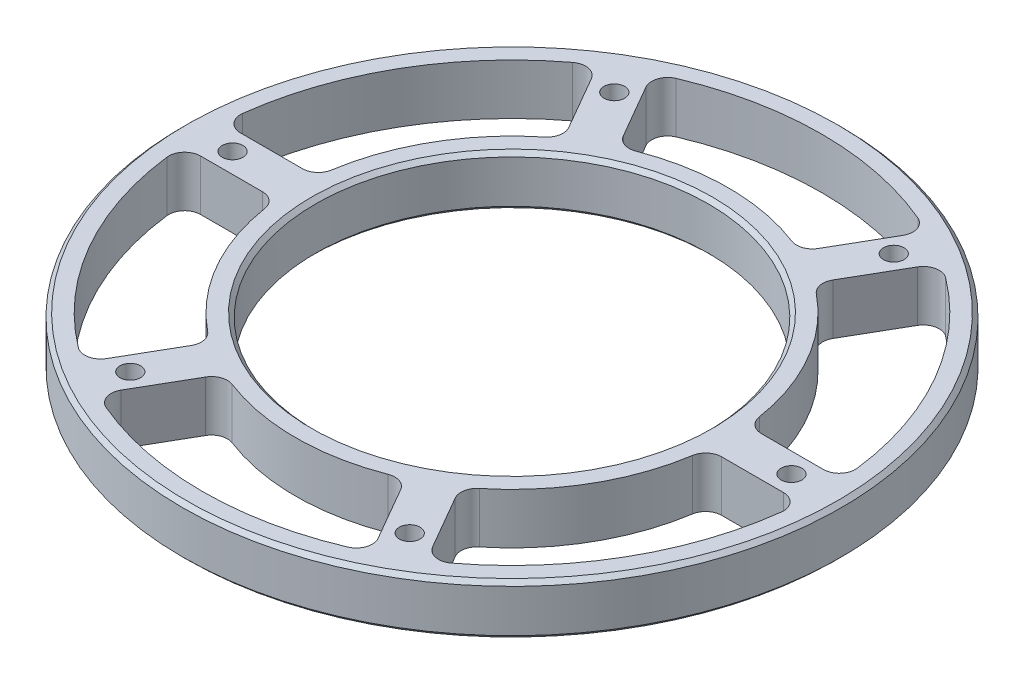
from build123d import *

# Parameters (mm, degrees)
F_6_0_204_DIAMETER_HOLE1_D = 5.1816
CIRPATTERN3_COUNT          = 6
CUT_EXTRUDE1_DEPTH         = 118.43208675655899
FILLET1_R                  = 4
CIRPATTERN4_COUNT          = 6
FILLET1_OF_CIRPATTERN4_R   = 4
CHAMFER1_SIZE              = 1
CHAMFER2_SIZE              = 1


with BuildPart() as part:
    # Sketch2 → Revolve1 (revolve)
    with BuildSketch(Plane(origin=(0, 0, 0), x_dir=(0, 0, -1), z_dir=(1, 0, 0))):
        Polygon((-49.2125, -4.7e-16), (-82.55, -4.08e-15), (-82.55, 12.699999999999996), (-49.2125, 12.699999999999996), align=None)
    revolve(axis=Axis((0, -0.6350000000000036, 0), (0, 1, 0)))

    # #6 (0.204) Diameter Hole1 (through all)
    with Locations(Plane(origin=(0, 12.699999999999996, 0), x_dir=(1, 0, 0), z_dir=(0, 1, 0))):
        with Locations((-35, 60.621778265)):
            f_6_0_204_diameter_hole1 = Hole(F_6_0_204_DIAMETER_HOLE1_D / 2)

    # CirPattern3: #6 (0.204) Diameter Hole1 ×6 about axis
    cirpattern3_axis = Axis((0, -0.6350000000000036, 0), (0, 1, 0))
    for i in range(1, CIRPATTERN3_COUNT):
        add(f_6_0_204_diameter_hole1.rotate(cirpattern3_axis, i * 360 / CIRPATTERN3_COUNT), mode=Mode.SUBTRACT)

    # Sketch8 → Cut-Extrude1 (cut, through all)
    with BuildSketch(Plane(origin=(0, 12.699999999999996, 0), x_dir=(1, 0, 0), z_dir=(0, 1, 0))):
        with BuildLine():
            Line((-22.660589701137386, 49.24929269184184), (-34.36419588509058, 69.52053323422602))
            ThreePointArc((-34.36419588509058, 69.52053323422602), (4.75e-15, 77.55000000000001), (34.36419588509058, 69.52053323422602))
            Line((34.36419588509058, 69.52053323422602), (22.660589701137386, 49.24929269184184))
            ThreePointArc((22.660589701137386, 49.24929269184184), (3.32e-15, 54.2125), (-22.660589701137386, 49.24929269184184))
        make_face()
    cut_extrude1 = extrude(amount=-CUT_EXTRUDE1_DEPTH, mode=Mode.SUBTRACT)

    # Fillet1
    fillet1_edges = [part.edges().sort_by_distance(p)[0] for p in [
        (-22.660589701137383, 6.349999999999998, -49.24929269184184),
        (22.66058970113739, 6.349999999999998, -49.249292691841845),
        (34.36419588509058, 6.349999999999998, -69.52053323422604),
        (-34.36419588509058, 6.349999999999998, -69.52053323422604),
    ]]
    fillet(fillet1_edges, radius=FILLET1_R)

    # CirPattern4: Cut-Extrude1 ×6 about axis
    cirpattern4_axis = Axis((0, -0.6350000000000036, 0), (0, 1, 0))
    for i in range(1, CIRPATTERN4_COUNT):
        add(cut_extrude1.rotate(cirpattern4_axis, i * 360 / CIRPATTERN4_COUNT), mode=Mode.SUBTRACT)

    # Fillet1 of CirPattern4
    fillet1_of_cirpattern4_edges = [part.edges().sort_by_distance(p)[0] for p in [
        (-53.98143344011902, 6.349999999999998, -4.9999999999999325),
        (-31.320843738981637, 6.349999999999998, -44.24929269184193),
        (-43.02444992293479, 6.349999999999998, -64.52053323422614),
        (-77.38864580802537, 6.349999999999998, -4.999999999999911),
        (-31.32084373898165, 6.349999999999998, 44.2492926918419),
        (-53.981433440119034, 6.349999999999998, 4.999999999999911),
        (-77.38864580802539, 6.349999999999998, 4.999999999999886),
        (-43.024449922934814, 6.349999999999998, 64.52053323422612),
        (22.660589701137376, 6.349999999999998, 49.24929269184184),
        (-22.660589701137397, 6.349999999999998, 49.249292691841845),
        (-34.36419588509059, 6.349999999999998, 69.52053323422604),
        (34.364195885090574, 6.349999999999998, 69.52053323422604),
        (53.98143344011902, 6.349999999999998, 4.999999999999954),
        (31.320843738981615, 6.349999999999998, 44.24929269184194),
        (43.024449922934764, 6.349999999999998, 64.52053323422615),
        (77.38864580802537, 6.349999999999998, 4.99999999999994),
        (31.320843738981637, 6.349999999999998, -44.249292691841916),
        (53.981433440119034, 6.349999999999998, -4.9999999999999325),
        (77.38864580802537, 6.349999999999998, -4.999999999999911),
        (43.02444992293479, 6.349999999999998, -64.52053323422614),
    ]]
    fillet(fillet1_of_cirpattern4_edges, radius=FILLET1_OF_CIRPATTERN4_R)

    # Chamfer1
    chamfer1_edges = [part.edges().sort_by_distance(p)[0] for p in [
        (6.03e-15, 12.699999999999996, -49.2125),
        (6.03e-15, -4.4e-16, -49.2125),
    ]]
    chamfer(chamfer1_edges, length=CHAMFER1_SIZE)

    # Chamfer2
    chamfer2_edges = [part.edges().sort_by_distance(p)[0] for p in [
        (4.677e-14, 12.699999999999996, -82.55),
        (4.677e-14, -4.11e-15, -82.55),
    ]]
    chamfer(chamfer2_edges, length=CHAMFER2_SIZE)


solid = part.part
